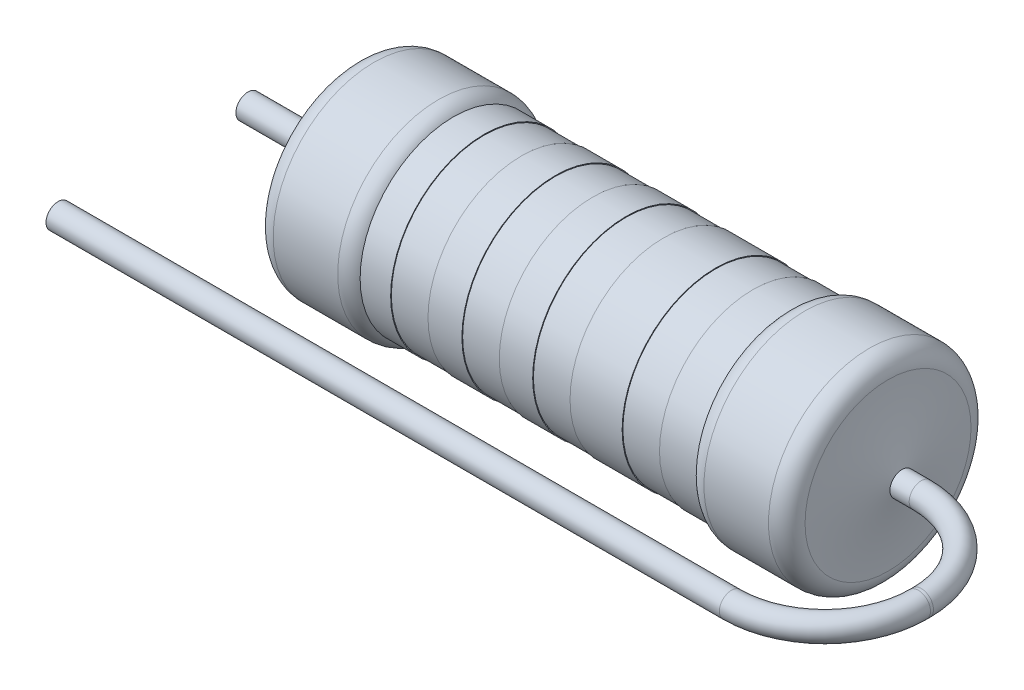
from build123d import *

# Parameters (mm, degrees)
FILLET1_R                = 0.5
FILLET2_R                = 0.5
BOSS_EXTRUDE1_DEPTH      = 2
BOSS_EXTRUDE1_DEPTH_BACK = 2.5
SKETCH8_R                = 0.325
SKETCH10_R               = 0.325


with BuildPart() as part:
    # Sketch3 → Revolve1 (revolve)
    with BuildSketch(Plane.XY, mode=Mode.PRIVATE) as revolve1_sk:
        with BuildLine():
            Line((-7.119211928, 2.7), (-4.5, 2.7))
            Line((-4.5, 2.7), (-4.5, 2.5))
            Line((-4.5, 2.5), (-3.684032732, 2.5))
            Line((-3.684032732, 2.5), (-3.684032732, 2.48))
            Line((-3.684032732, 2.48), (-2.684032732, 2.48))
            Line((-2.684032732, 2.48), (-2.684032732, 2.5))
            Line((-2.684032732, 2.5), (-1.776827573, 2.5))
            Line((-1.776827573, 2.5), (-1.776827573, 2.48))
            Line((-1.776827573, 2.48), (-0.776827573, 2.48))
            Line((-0.776827573, 2.48), (-0.776827573, 2.5))
            Line((-0.776827573, 2.5), (0.116851308, 2.5))
            Line((0.116851308, 2.5), (0.116851308, 2.48))
            Line((0.116851308, 2.48), (1.116851308, 2.48))
            Line((1.116851308, 2.48), (1.116851308, 2.5))
            Line((1.116851308, 2.5), (2.511002465, 2.5))
            Line((2.511002465, 2.5), (2.511002465, 2.48))
            Line((2.511002465, 2.48), (3.511002465, 2.48))
            Line((3.511002465, 2.48), (3.511002465, 2.5))
            Line((3.511002465, 2.5), (4.5, 2.5))
            Line((4.5, 2.5), (4.5, 2.7))
            Line((4.5, 2.7), (7.119211928, 2.7))
            add(Edge.make_bspline(
                [(7.119211928, 2.7), (7.102867944, 1.325176063), (7.5, 0)],
                knots=[0, 0, 0, 1, 1, 1], degree=2))
            Line((7.5, 0), (-7.5, 0))
            add(Edge.make_bspline(
                [(-7.119211928, 2.7), (-7.102867944, 1.325176063), (-7.5, 0)],
                knots=[0, 0, 0, 1, 1, 1], degree=2))
        make_face()
    revolve(revolve1_sk.sketch.rotate(Axis((-9.028162595, 0, 0), (1, 0, 0)), 180), axis=Axis((-9.028162595, 0, 0), (1, 0, 0)))

    # Fillet1
    fillet1_edges = [part.edges().sort_by_distance(p)[0] for p in [
        (-7.119211928, 2.7, 0),
        (7.119211928, 2.7, 0),
    ]]
    fillet(fillet1_edges, radius=FILLET1_R)

    # Fillet2
    # the kernel refuses this fillet: 0.5 mm, written as the material it takes off along each edge
    with BuildSketch(Plane(origin=(-4.5, 0, 0), x_dir=(0, -1, 0), z_dir=(0, 0, 1))) as fillet2_piece_1:
        with BuildLine():
            CenterArc((2.2, -0.4), FILLET2_R, 0, 53.130102355)
            Line((2.5, 0), (2.506, 0.008))
            ThreePointArc((2.506, 0.008), (2.6, 0.01), (2.7, 0.01))
            Line((2.7, 0.01), (2.71, 0))
            Line((2.71, 0), (2.71, -0.4))
            Line((2.71, -0.4), (2.7, -0.4))
        make_face()
    revolve(axis=Axis((-4.5, 0, 0), (1, 0, 0)), mode=Mode.SUBTRACT)
    with BuildSketch(Plane(origin=(4.5, 0, 0), x_dir=(0, -1, 0), z_dir=(0, 0, 1))) as fillet2_piece_2:
        with BuildLine():
            CenterArc((2.2, 0.4), FILLET2_R, 306.869897645, 53.130102355)
            Line((2.7, 0.4), (2.71, 0.4))
            Line((2.71, 0.4), (2.71, 0))
            Line((2.71, 0), (2.7, -0.01))
            ThreePointArc((2.7, -0.01), (2.6, -0.01), (2.506, -0.008))
            Line((2.506, -0.008), (2.5, 0))
        make_face()
    revolve(axis=Axis((4.5, 0, 0), (1, 0, 0)), mode=Mode.SUBTRACT)

    # Sketch8 → Boss-Extrude1 (add, two sides: drawn at the far end of the back side and taken through both)
    with BuildSketch(Plane(origin=(-7.5, 0, 0), x_dir=(0, 0, -1), z_dir=(1, 0, 0)).offset(-BOSS_EXTRUDE1_DEPTH_BACK)):
        Circle(SKETCH8_R)
    extrude(amount=BOSS_EXTRUDE1_DEPTH + BOSS_EXTRUDE1_DEPTH_BACK)


with BuildPart() as body_2:
    # Sweep1: sweep along a path in Sketch9
    with BuildLine(Plane(origin=(0, 0, 0), x_dir=(1, 0, 0), z_dir=(0, 1, 0))) as sweep1_path:
        Line((7.5, 0), (8.016727075, 0))
        ThreePointArc((8.016727075, 0), (9.784494028, -0.732233047), (10.516727075, -2.5))
        Line((10.516727075, -2.5), (10.516727075, -2.58))
        ThreePointArc((10.516727075, -2.58), (9.784494028, -4.347766953), (8.016727075, -5.08))
        Line((8.016727075, -5.08), (-10, -5.08))
    # Sketch10 → Sweep1 (sweep)
    with BuildSketch(Plane(origin=(7.5, 0, 0), x_dir=(0, 0, -1), z_dir=(1, 0, 0))):
        Circle(SKETCH10_R)
    sweep(path=sweep1_path.line)


solid = Compound([part.part, body_2.part])
